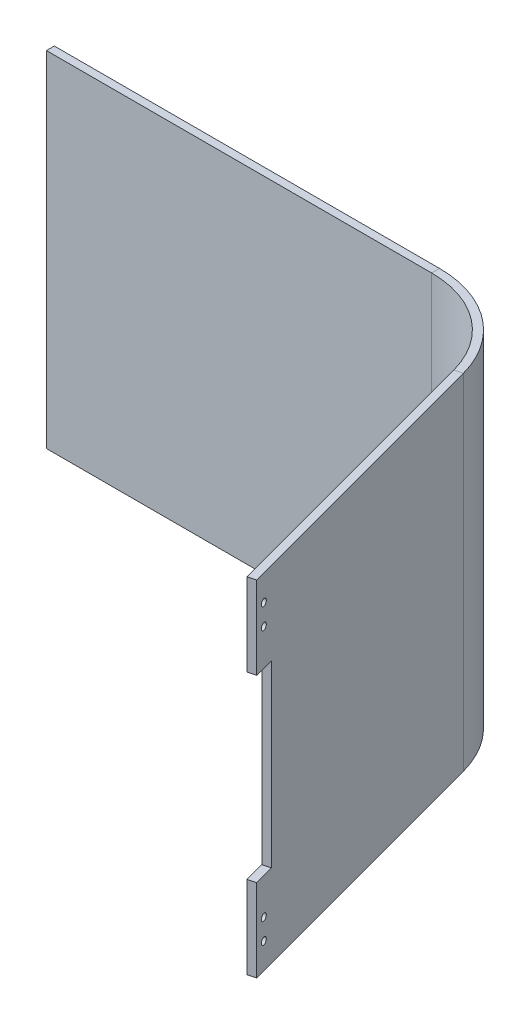
from build123d import *

# Parameters (mm, degrees)
ESBO_O1_W                = 425
ESBO_O1_H                = 175
FLANGE_BASE1_DEPTH       = 4
ESBO_O11_W               = 10.6
ESBO_O11_H               = 90.6
CORTE_EXTRUS_O2_DEPTH    = 155
DOBRA_ESBO_ADA1_DEPTH    = 175
DOBRA_ESBO_ADA1_2_DEPTH  = 175
DOBRA_ESBO_ADA1_3_DEPTH  = 42.2
DOBRA_START              = 132.8
DOBRA_ESBO_ADA1_4_DEPTH  = 42.2
ESBO_O14_R               = 1.75
CORTE_EXTRUS_O3_DEPTH    = 6
ESBO_O15_W               = 10.6
ESBO_O15_H               = 91.1
CORTE_EXTRUS_O4_DEPTH    = 44
ESBO_O16_W               = 2
ESBO_O16_H               = 4
RESSALTO_EXTRUS_O1_DEPTH = 175


# Read off the part's stored shape, not the designer's step: Dobra esboçada1
# Sheet-metal steps are written as plain solids
with BuildPart() as part:
    # Esboço1 → Flange-base1 (new body)
    with BuildSketch(Plane.XY):
        with Locations((212.5, 87.5)):
            Rectangle(ESBO_O1_W, ESBO_O1_H)
    extrude(amount=-FLANGE_BASE1_DEPTH)

    # Esboço11 → Corte-extrusão2 (cut)
    with BuildSketch(Plane(origin=(0, 0, -4), x_dir=(-1, 0, 0), z_dir=(0, 0, -1))):
        Polygon((-425, 175), (-425, 0), (-410.6, 0), (-410.6, 42.2), (-410.6, 132.8), (-410.6, 175), align=None)
        with Locations((-405.3, 87.5)):
            Rectangle(ESBO_O11_W, ESBO_O11_H)
    extrude(amount=-CORTE_EXTRUS_O2_DEPTH, mode=Mode.SUBTRACT)

    # Dobra esboçada1 outline → Dobra esboçada1 (cut)
    with BuildSketch(Plane(origin=(0, 0, 0), x_dir=(1, 0, 0), z_dir=(0, 1, 0))):
        with BuildLine():
            ThreePointArc((193.564342649, 4), (203.956647495, 2.990565198), (213.960420704, 0))
            Line((213.960420704, 0), (410.6, 0))
            Line((410.6, 0), (410.6, 4))
            Line((410.6, 4), (193.564342649, 4))
        make_face()
    extrude(amount=DOBRA_ESBO_ADA1_DEPTH, mode=Mode.SUBTRACT)

    # Dobra esbo_ada1 2 outline → Dobra esbo_ada1 2 (add)
    with BuildSketch(Plane(origin=(0, 0, 0), x_dir=(1, 0, 0), z_dir=(0, 1, 0))):
        with BuildLine():
            Line((277.537342774, -170.206337672), (281.401046079, -169.171061491))
            Line((281.401046079, -169.171061491), (245.724337269, -36.023771564))
            ThreePointArc((245.724337269, -36.023771564), (234.067724606, -14.286192444), (213.960420704, 0))
            Line((213.960420704, 0), (193.564342649, 0))
            ThreePointArc((193.564342649, 0), (224.0024141, -10.332332985), (241.860633964, -37.059047745))
            Line((241.860633964, -37.059047745), (277.537342774, -170.206337672))
        make_face()
    extrude(amount=DOBRA_ESBO_ADA1_2_DEPTH)

    # Dobra esbo_ada1 3 outline → Dobra esbo_ada1 3 (add)
    with BuildSketch(Plane(origin=(0, 0, 0), x_dir=(1, 0, 0), z_dir=(0, 1, 0))):
        Polygon((280.280824652, -180.44515143), (284.144527957, -179.40987525), (281.401046079, -169.171061491), (277.537342774, -170.206337672), align=None)
    extrude(amount=DOBRA_ESBO_ADA1_3_DEPTH)

    # Dobra esbo_ada1 4 outline → Dobra esbo_ada1 4 (add)
    with BuildSketch(Plane(origin=(0, 0, 0), x_dir=(1, 0, 0), z_dir=(0, 1, 0)).offset(DOBRA_START)):
        Polygon((280.280824652, -180.44515143), (284.144527957, -179.40987525), (281.401046079, -169.171061491), (277.537342774, -170.206337672), align=None)
    extrude(amount=DOBRA_ESBO_ADA1_4_DEPTH)

    # Esboço14 → Corte-extrusão3 (cut)
    with BuildSketch(Plane(origin=(220.257984945, 0, -59.017949192), x_dir=(-0.25881904510251796, 0, -0.9659258262890691), z_dir=(0.9659258262890691, 0, -0.25881904510251796))):
        with Locations((-241.688647392, 13.1)):
            Circle(ESBO_O14_R)
        with Locations((-241.688647392, 23.6)):
            Circle(ESBO_O14_R)
    corte_extrus_o3 = extrude(amount=-CORTE_EXTRUS_O3_DEPTH, mode=Mode.SUBTRACT)

    # Espelhar1: Corte-extrusão3 across plane
    add(corte_extrus_o3.mirror(Plane(origin=(0, 87.5, 0), x_dir=(0, 0, 1), z_dir=(0, -1, 0))), mode=Mode.SUBTRACT)

    # Esboço15 → Corte-extrusão4 (cut)
    with BuildSketch(Plane(origin=(220.257984945, 0, -59.017949192), x_dir=(-0.25881904510251796, 0, -0.9659258262890691), z_dir=(0.9659258262890691, 0, -0.25881904510251796))):
        with Locations((-241.538647392, 87.5)):
            Rectangle(ESBO_O15_W, ESBO_O15_H)
    extrude(amount=-CORTE_EXTRUS_O4_DEPTH, mode=Mode.SUBTRACT)

    # Esboço16 → Ressalto-extrusão1 (add)
    with BuildSketch(Plane.XZ):
        with Locations((-1, -2)):
            Rectangle(ESBO_O16_W, ESBO_O16_H)
    extrude(amount=-RESSALTO_EXTRUS_O1_DEPTH)


solid = part.part
